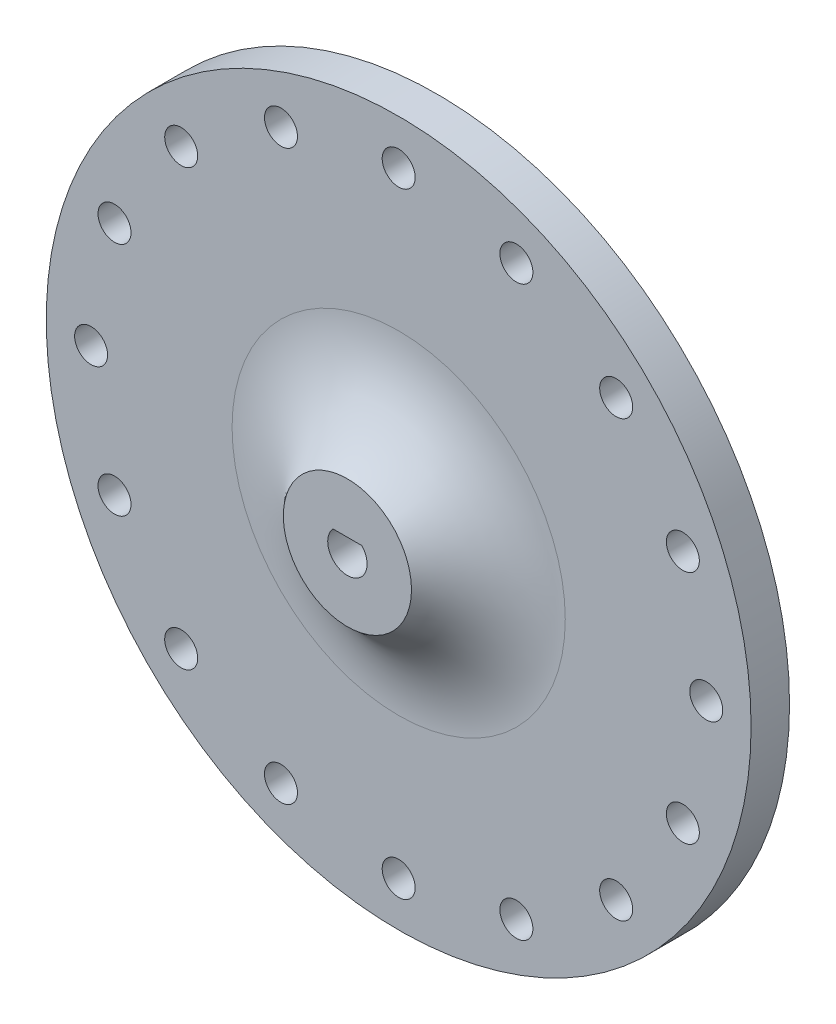
from build123d import *
from build123d.topology import SkipClean

# Parameters (mm, degrees)
ESBO_O1_R                = 55
RESSALTO_EXTRUS_O1_DEPTH = 6
ESBO_O2_R                = 10
RESSALTO_EXTRUS_O2_DEPTH = 8
FILETE3_R                = 20
ESBO_O3_R                = 2.575
CORTE_EXTRUS_O1_DEPTH    = 79.192071209
PADR_OCIRCULAR1_COUNT    = 16
CORTE_EXTRUS_O2_DEPTH    = 79.192071209


with BuildPart() as part:
    # Esboço1 → Ressalto-extrusão1 (new body)
    with BuildSketch(Plane.XY):
        Circle(ESBO_O1_R)
    extrude(amount=RESSALTO_EXTRUS_O1_DEPTH)

    # Esboço2 → Ressalto-extrusão2 (add)
    with BuildSketch(Plane.XY.offset(6)):
        Circle(ESBO_O2_R)
        with BuildLine():
            Line((-2.24624687, 2.1), (2.24624687, 2.1))
            ThreePointArc((2.24624687, 2.1), (0, -3.075), (-2.24624687, 2.1))
        make_face(mode=Mode.SUBTRACT)
    extrude(amount=RESSALTO_EXTRUS_O2_DEPTH)

    # Filete3
    # the kernel refuses this fillet: 20 mm, written as the material it adds along each edge
    with BuildSketch(Plane(origin=(0, 0, 6), x_dir=(1, 0, 0), z_dir=(0, -1, 0))) as filete3_piece_1:
        with BuildLine():
            CenterArc((26, 20), FILETE3_R, 216.869897646, 53.130102354)
            Line((10, 8), (9.68, 7.76))
            ThreePointArc((9.68, 7.76), (9.6, 4), (9.6, 0))
            Line((9.6, 0), (10, -0.4))
            Line((10, -0.4), (26, -0.4))
            Line((26, -0.4), (26, 0))
        make_face()
    revolve(axis=Axis((0, 0, 6), (0, 0, 1)))

    # Esboço3 → Corte-extrusão1 (cut, through all)
    with BuildSketch(Plane.XY.offset(6)):
        with Locations((0, 48)):
            Circle(ESBO_O3_R)
    corte_extrus_o1 = extrude(amount=-CORTE_EXTRUS_O1_DEPTH, mode=Mode.SUBTRACT)

    # PadrãoCircular1: Corte-extrusão1 ×16 about axis
    padr_ocircular1_axis = Axis((0, 0, 0), (0, 0, 1))
    for i in range(1, PADR_OCIRCULAR1_COUNT):
        add(corte_extrus_o1.rotate(padr_ocircular1_axis, i * 360 / PADR_OCIRCULAR1_COUNT), mode=Mode.SUBTRACT)

    # Esboço4 → Corte-extrusão2 (cut, through all)
    with SkipClean():  # the faces are left unmerged after this step: merging them gives an invalid solid
        with BuildSketch(Plane.XY.offset(6)):
            with BuildLine():
                Line((2.24624687, 2.1), (-2.24624687, 2.1))
                ThreePointArc((-2.24624687, 2.1), (0, -3.075), (2.24624687, 2.1))
            make_face()
        extrude(amount=-CORTE_EXTRUS_O2_DEPTH, mode=Mode.SUBTRACT)
    add(part.part.scale(1), mode=Mode.REPLACE)  # the faces are merged on a copy


solid = part.part
